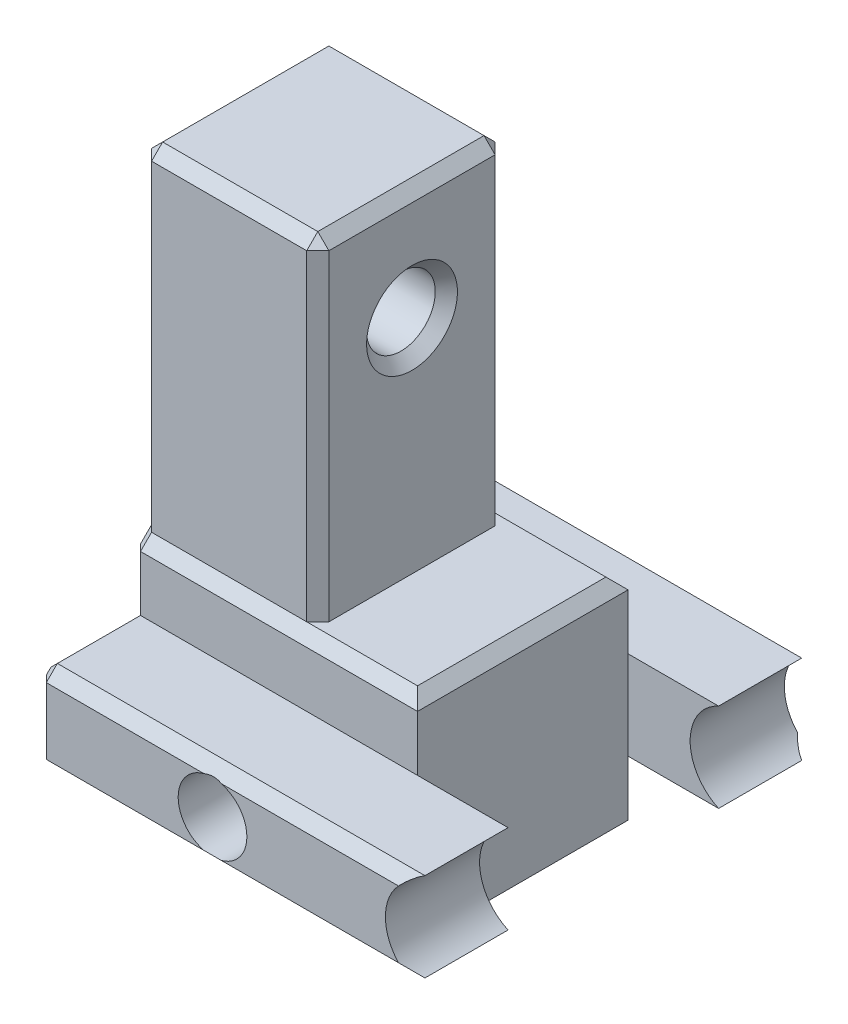
from build123d import *

# Parameters (mm, degrees)
BOSS_EXTRUDE1_DEPTH  = 18
BOSS_EXTRUDE2_START  = -49.083485
SKETCH2_W            = 9.5
SKETCH2_H            = 10
BOSS_EXTRUDE2_DEPTH  = 49.083485
M3_CLEARANCE_HOLE1_D = 3.1
BOSS_EXTRUDE3_DEPTH  = 1.5
CHAMFER1_SIZE        = 0.5
SKETCH8_W            = 5
SKETCH8_H            = 9.5
CUT_EXTRUDE1_DEPTH   = 56.463952257
SKETCH9_W            = 8
SKETCH9_H            = 8.5
BOSS_EXTRUDE4_DEPTH  = 15
SKETCH13_W           = 33.5
SKETCH13_H           = 18
CUT_EXTRUDE5_DEPTH   = 61.010415763
SKETCH10_R           = 1.55
CUT_EXTRUDE6_DEPTH   = 2.6
CHAMFER2_SIZE        = 0.5


with BuildPart() as part:
    # Sketch1 → Boss-Extrude1 (new body)
    with BuildSketch(Plane.XY):
        with BuildLine():
            Line((-0.916515139, 2), (-50, 2))
            Line((-50, 2), (-50, -2))
            Line((-50, -2), (-0.916515139, -2))
            ThreePointArc((-0.916515139, -2), (-2.2, 0), (-0.916515139, 2))
        make_face()
    extrude(amount=BOSS_EXTRUDE1_DEPTH)

    # Sketch2 → Boss-Extrude2 (add)
    with BuildSketch(Plane.ZY.offset(50).offset(BOSS_EXTRUDE2_START)):
        with Locations((9, 0)):
            Rectangle(SKETCH2_W, SKETCH2_H)
    extrude(amount=BOSS_EXTRUDE2_DEPTH)

    # M3 Clearance Hole1 (through all)
    with Locations(Plane.XY.offset(18)):
        with Locations((-10, 0)):
            Hole(M3_CLEARANCE_HOLE1_D / 2)

    # Sketch7 → Boss-Extrude3 (add)
    with BuildSketch(Plane.ZY.offset(50)):
        Polygon((0, 2), (0, -2), (4.25, -2), (4.25, -5), (13.75, -5), (13.75, -2), (18, -2), (18, 2), (13.75, 2), (13.75, 5), (4.25, 5), (4.25, 2), align=None)
    extrude(amount=BOSS_EXTRUDE3_DEPTH)

    # Chamfer1
    # the kernel refuses this chamfer: 0.5 mm, written as the material it takes off along each edge
    with BuildSketch(Plane(origin=(-52.785841494, -2, 18), x_dir=(0, 0.9996219169112968, 0.027495876610589075), z_dir=(1, 0, 0)), Plane(origin=(0.369326355, 2, 0), x_dir=(0, 0.027495876610586494, 0.9996219169112968), z_dir=(-1, 0, 0))) as chamfer1_piece_1:
        Polygon((CHAMFER1_SIZE * 0.999621916911, -CHAMFER1_SIZE * 0.0274958766106), (-CHAMFER1_SIZE * 0.0274958766106, -CHAMFER1_SIZE * 0.999621916911), (0, 0), align=None)
    extrude(amount=53.155167849, mode=Mode.SUBTRACT)
    with BuildSketch(Plane(origin=(0.369326494, -5, 4.25), x_dir=(0, -0.027495876610585647, 0.9996219169112968), z_dir=(-1, 0, 0)), Plane(origin=(-52.785841494, 5, 4.25), x_dir=(0, 0.027495876610585647, 0.9996219169112968), z_dir=(1, 0, 0)), Plane(origin=(0.369326494, -5, 13.75), x_dir=(0, 0.9996219169112968, 0.027495876610585647), z_dir=(-1, 0, 0))) as chamfer1_piece_2:
        Polygon((CHAMFER1_SIZE * 0.999621916911, CHAMFER1_SIZE * 0.0274958766106), (-CHAMFER1_SIZE * 0.0274958766106, CHAMFER1_SIZE * 0.999621916911), (0, 0), align=None)
    extrude(amount=53.155167988, mode=Mode.SUBTRACT)
    with BuildSketch(Plane(origin=(-52.785841494, 5, 13.75), x_dir=(0, 0.027495876610585647, -0.9996219169112968), z_dir=(1, 0, 0))) as chamfer1_piece_3:
        Polygon((CHAMFER1_SIZE * 0.999621916911, -CHAMFER1_SIZE * 0.0274958766106), (-CHAMFER1_SIZE * 0.0274958766106, -CHAMFER1_SIZE * 0.999621916911), (0, 0), align=None)
    extrude(amount=53.155167988, mode=Mode.SUBTRACT)
    with BuildSketch(Plane(origin=(0.369326355, -2, 0), x_dir=(0, -0.027495876610586494, 0.9996219169112968), z_dir=(-1, 0, 0)), Plane(origin=(0.369326355, 2, 18), x_dir=(0, 0.027495876610586414, -0.9996219169112968), z_dir=(-1, 0, 0))) as chamfer1_piece_4:
        Polygon((CHAMFER1_SIZE * 0.999621916911, CHAMFER1_SIZE * 0.0274958766106), (-CHAMFER1_SIZE * 0.0274958766106, CHAMFER1_SIZE * 0.999621916911), (0, 0), align=None)
    extrude(amount=53.155167849, mode=Mode.SUBTRACT)

    # Sketch8 → Cut-Extrude1 (cut, through all)
    with BuildSketch(Plane(origin=(0, 5, 0), x_dir=(1, 0, 0), z_dir=(0, 1, 0))):
        with Locations((-2.5, -9)):
            Rectangle(SKETCH8_W, SKETCH8_H)
    extrude(amount=-CUT_EXTRUDE1_DEPTH, mode=Mode.SUBTRACT)

    # Sketch9 → Boss-Extrude4 (add)
    with BuildSketch(Plane(origin=(0, 5, 0), x_dir=(1, 0, 0), z_dir=(0, 1, 0))):
        with Locations((-14, -9)):
            Rectangle(SKETCH9_W, SKETCH9_H)
    extrude(amount=BOSS_EXTRUDE4_DEPTH)

    # Sketch13 → Cut-Extrude5 (cut, through all)
    with BuildSketch(Plane(origin=(0, 20, 0), x_dir=(1, 0, 0), z_dir=(0, 1, 0))):
        with Locations((-34.75, -9)):
            Rectangle(SKETCH13_W, SKETCH13_H)
    extrude(amount=-CUT_EXTRUDE5_DEPTH, mode=Mode.SUBTRACT)

    # Sketch10 → Cut-Extrude6 (cut)
    with BuildSketch(Plane.ZY.offset(10)):
        with Locations((9, 15)):
            Circle(SKETCH10_R)
    extrude(amount=CUT_EXTRUDE6_DEPTH, mode=Mode.SUBTRACT)

    # Chamfer2
    chamfer2_edges = [part.edges().sort_by_distance(p)[0] for p in [
        (-5, -5, 9),
        (-5, 5, 9),
        (-10, 12.5, 13.25),
        (-10, 12.5, 4.75),
        (-18, 12.5, 4.75),
        (-18, 12.5, 13.25),
        (-10, 20, 9),
        (-14, 20, 4.75),
        (-18, 20, 9),
        (-14, 20, 13.25),
        (-18, -3.25, 4.25),
        (-18, -4.75, 4.5),
        (-18, -1.75, 0.25),
        (-18, -4.75, 13.5),
        (-18, -3.25, 13.75),
        (-18, -1.75, 17.75),
        (-18, 1.75, 0.25),
        (-18, 4.75, 4.5),
        (-18, 3.25, 4.25),
        (-18, 1.75, 17.75),
        (-18, 3.25, 13.75),
        (-18, 4.75, 13.5),
        (-18, 2, 15.625),
        (-18, -2, 15.625),
        (-18, -5, 9),
        (-18, -2, 2.375),
        (-18, 0, 0),
        (-18, 2, 2.375),
        (-18, 0, 18),
        (-10, 15, 7.45),
    ]]
    chamfer(chamfer2_edges, length=CHAMFER2_SIZE)


solid = part.part
